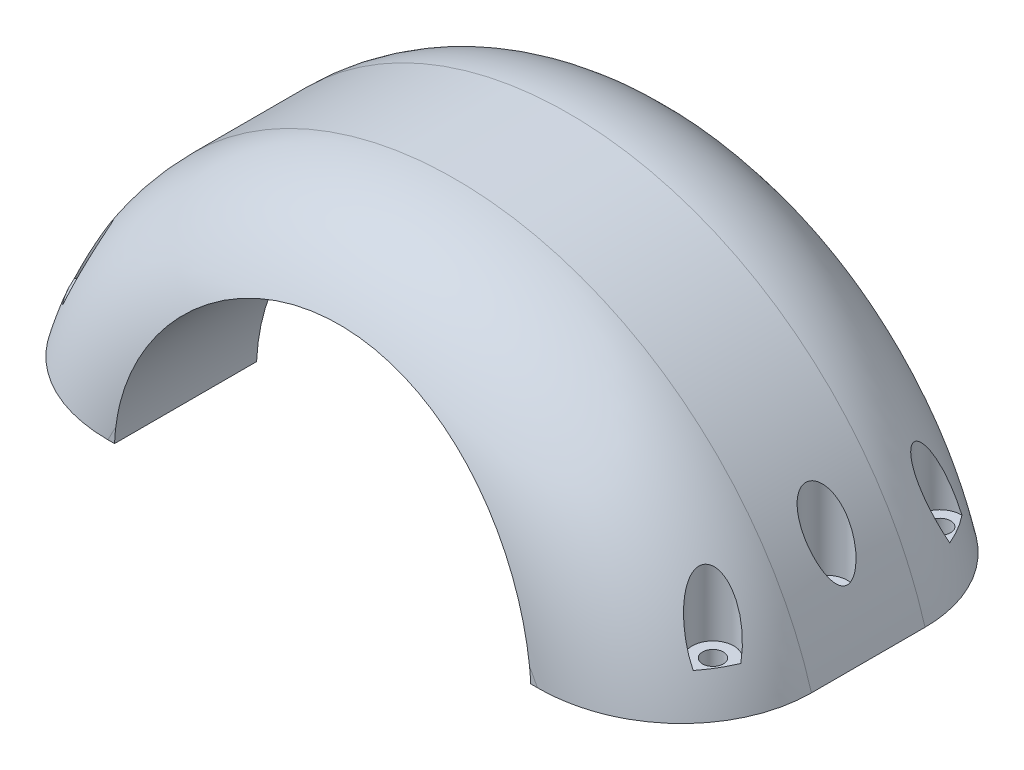
from build123d import *

# Parameters (mm, degrees)
BOSS_EXTRUDE1_DEPTH = 100
CUT_EXTRUDE1_DEPTH  = 12.5
FILLET1_R           = 35
FILLET2_R           = 35
SKETCH5_R           = 2.75
CUT_EXTRUDE2_DEPTH  = 10
SKETCH6_R           = 5.5
CUT_EXTRUDE3_DEPTH  = 151.026664466


with BuildPart() as part:
    # Sketch3 → Boss-Extrude1 (new body)
    with BuildSketch(Plane.XY):
        with BuildLine():
            Line((-94.062479236, 2.5), (-54.94315244, 2.5))
            ThreePointArc((-54.94315244, 2.5), (0, 55), (54.94315244, 2.5))
            Line((54.94315244, 2.5), (94.062479236, 2.5))
            ThreePointArc((94.062479236, 2.5), (0, 73), (-94.062479236, 2.5))
        make_face()
    extrude(amount=BOSS_EXTRUDE1_DEPTH)

    # Sketch4 → Cut-Extrude1 (cut, symmetric)
    with BuildSketch(Plane.XY.offset(50)):
        with BuildLine():
            Line((54.94315244, 2.5), (69.955342898, 2.5))
            ThreePointArc((69.955342898, 2.5), (0, 70), (-69.955342898, 2.5))
            Line((-69.955342898, 2.5), (-54.94315244, 2.5))
            ThreePointArc((-54.94315244, 2.5), (0, 55), (54.94315244, 2.5))
        make_face()
    extrude(amount=CUT_EXTRUDE1_DEPTH, both=True, mode=Mode.SUBTRACT)

    # Fillet1
    # the kernel refuses this fillet: 35 mm, written as the material it takes off along each edge
    with BuildSketch(Plane(origin=(0, -25, 0), x_dir=(0.8199985620272532, -0.5723655809648559, 0), z_dir=(-0.5723655809648559, -0.8199985620272532, 0))) as fillet1_piece_1:
        with BuildLine():
            CenterArc((98 - FILLET1_R, FILLET1_R), FILLET1_R, 270, 90)
            Line((98, FILLET1_R), (98, 0))
            Line((98, 0), (98 - FILLET1_R, 0))
        make_face()
    revolve(axis=Axis((0, -25, 0), (0, 0, 1)), revolution_arc=249.830700388, mode=Mode.SUBTRACT)

    # Fillet2
    # the kernel refuses this fillet: 35 mm, written as the material it takes off along each edge
    with BuildSketch(Plane(origin=(0, -25, 100), x_dir=(0.8199985620272531, -0.5723655809648561, 0), z_dir=(-0.5723655809648561, -0.8199985620272531, 0))) as fillet2_piece_1:
        with BuildLine():
            CenterArc((98 - FILLET2_R, -FILLET2_R), FILLET2_R, 0, 90)
            Line((98, -FILLET2_R), (98, 0))
            Line((98, 0), (98 - FILLET2_R, 0))
        make_face()
    revolve(axis=Axis((0, -25, 100), (0, 0, 1)), revolution_arc=249.830700388, mode=Mode.SUBTRACT)

    # Sketch5 → Cut-Extrude2 (cut)
    with BuildSketch(Plane.XZ.offset(-2.5)):
        with Locations((83.062479236, 80)):
            Circle(SKETCH5_R)
        with Locations((83.062479236, 50)):
            Circle(SKETCH5_R)
        with Locations((83.062479236, 20)):
            Circle(SKETCH5_R)
    cut_extrude2 = extrude(amount=-CUT_EXTRUDE2_DEPTH, mode=Mode.SUBTRACT)

    # Sketch6 → Cut-Extrude3 (cut, through all)
    with BuildSketch(Plane.XZ.offset(-12.5)):
        with Locations((83.062479236, 20)):
            Circle(SKETCH6_R)
        with Locations((83.062479236, 50)):
            Circle(SKETCH6_R)
        with Locations((83.062479236, 80)):
            Circle(SKETCH6_R)
    cut_extrude3 = extrude(amount=-CUT_EXTRUDE3_DEPTH, mode=Mode.SUBTRACT)

    # Mirror6: Cut-Extrude2, Cut-Extrude3 across plane
    add(cut_extrude2.mirror(Plane(origin=(0, 0, 0), x_dir=(0, 0, 1), z_dir=(1, 0, 0))), mode=Mode.SUBTRACT)
    add(cut_extrude3.mirror(Plane(origin=(0, 0, 0), x_dir=(0, 0, 1), z_dir=(1, 0, 0))), mode=Mode.SUBTRACT)


solid = part.part
